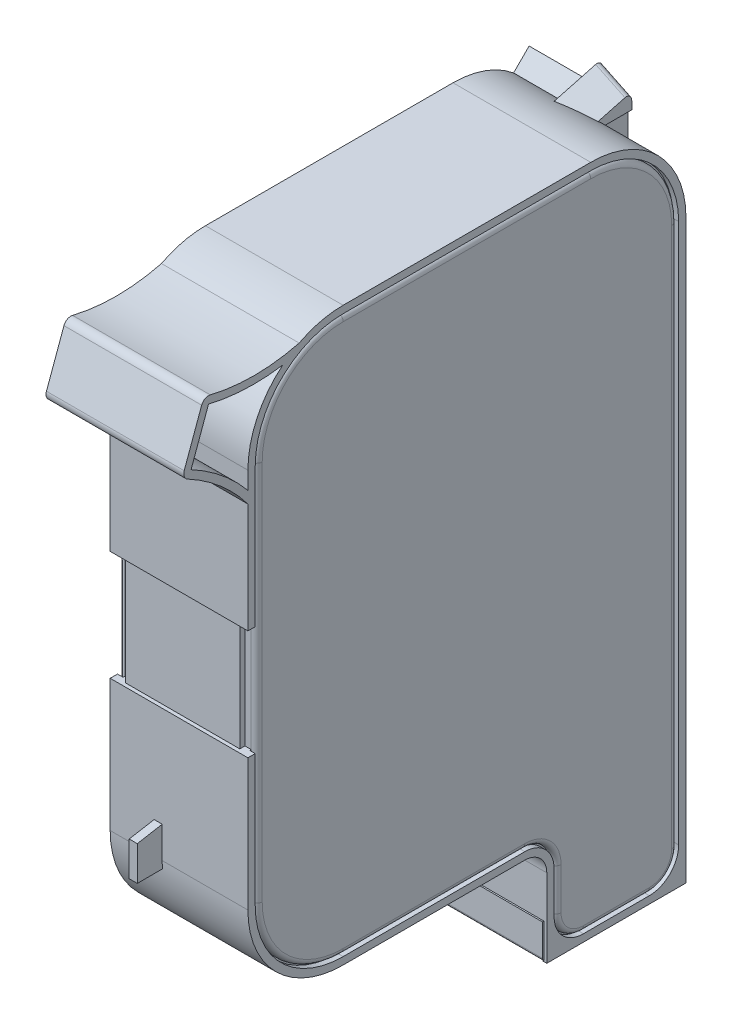
from build123d import *

# Parameters (mm, degrees)
BOSS_EXTRUDE1_DEPTH     = 9.4
CUT_EXTRUDE_THIN1_DEPTH = 0.75
FILLET1_R               = 0.75
BOSS_EXTRUDE2_DEPTH     = 4
CHAMFER1_SIZE           = 1
BOSS_EXTRUDE3_START     = -1.5
BOSS_EXTRUDE3_DEPTH     = 1.5
SKETCH6_W               = 5
SKETCH6_H               = 4
BOSS_EXTRUDE4_DEPTH     = 0.5
BOSS_EXTRUDE4_TAPER     = 45
BOSS_EXTRUDE5_DEPTH     = 18.8
BOSS_EXTRUDE6_START     = -4.5
BOSS_EXTRUDE6_DEPTH     = 2
SKETCH9_W               = 7.088876853
SKETCH9_H               = 8.7
BOSS_EXTRUDE7_DEPTH     = 1
CHAMFER2_SIZE           = 0.5
BOSS_EXTRUDE8_DEPTH     = 2
CUT_EXTRUDE1_DEPTH      = 116.126614853
FILLET2_R               = 0.75
BOSS_EXTRUDE9_REACH     = 118.028
CUT_EXTRUDE2_DEPTH      = 96.832813297
SKETCH15_W              = 18.8
SKETCH15_H              = 15
CUT_EXTRUDE3_DEPTH      = 0.5
CUT_EXTRUDE4_START      = -0.7
SKETCH16_W              = 1.6
SKETCH16_H              = 15
CUT_EXTRUDE4_DEPTH      = 0.7
BOSS_EXTRUDE10_START    = -7.1
BOSS_EXTRUDE10_DEPTH    = 1.1
SKETCH18_W              = 17.8
SKETCH18_H              = 19
CUT_EXTRUDE5_DEPTH      = 0.3
EXTRUDE_THIN1_DEPTH     = 9
SKETCH21_W              = 1.6
SKETCH21_H              = 1.9
BOSS_EXTRUDE11_DEPTH    = 0.1
SKETCH22_W              = 1
SKETCH22_H              = 4.4
BOSS_EXTRUDE12_DEPTH    = 0.3
SKETCH23_R              = 5
BOSS_EXTRUDE13_DEPTH    = 0.5


with BuildPart() as part:
    # Sketch1 → Boss-Extrude1 (new, symmetric)
    with BuildSketch(Plane(origin=(0, 0, 0), x_dir=(0, 0, -1), z_dir=(1, 0, 0))):
        with BuildLine():
            Line((0, 0), (-19, 0))
            Line((-19, 0), (-19, 10.7))
            ThreePointArc((-19, 10.7), (-19.878679656, 12.821320344), (-22, 13.7))
            Line((-22, 13.7), (-46.8, 13.7))
            ThreePointArc((-46.8, 13.7), (-55.992388155, 17.507611845), (-59.8, 26.7))
            Line((-59.8, 26.7), (-59.8, 78.7))
            ThreePointArc((-59.8, 78.7), (-55.992388155, 87.892388155), (-46.8, 91.7))
            Line((-46.8, 91.7), (-13, 91.7))
            ThreePointArc((-13, 91.7), (-3.807611845, 87.892388155), (0, 78.7))
            Line((0, 78.7), (0, 0))
        make_face()
    extrude(amount=BOSS_EXTRUDE1_DEPTH, both=True)

    # Sketch2 → Cut-Extrude-Thin1 (cut)
    with BuildSketch(Plane(origin=(9.4, 0, 0), x_dir=(0, 0, -1), z_dir=(1, 0, 0))):
        with BuildLine():
            Line((-18, 10.7), (-18, 5))
            ThreePointArc((-18, 5), (-16.828427125, 2.171572875), (-14, 1))
            Line((-14, 1), (-5, 1))
            ThreePointArc((-5, 1), (-2.171572875, 2.171572875), (-1, 5))
            Line((-1, 5), (-1, 78.7))
            ThreePointArc((-1, 78.7), (-4.514718626, 87.185281374), (-13, 90.7))
            Line((-13, 90.7), (-46.8, 90.7))
            ThreePointArc((-46.8, 90.7), (-55.285281374, 87.185281374), (-58.8, 78.7))
            Line((-58.8, 78.7), (-58.8, 26.7))
            ThreePointArc((-58.8, 26.7), (-55.285281374, 18.214718626), (-46.8, 14.7))
            Line((-46.8, 14.7), (-22, 14.7))
            ThreePointArc((-22, 14.7), (-19.171572875, 13.528427125), (-18, 10.7))
        make_face()
        with BuildLine():
            Line((-17.8, 10.7), (-17.8, 5))
            ThreePointArc((-17.8, 5), (-16.687005769, 2.312994231), (-14, 1.2))
            Line((-14, 1.2), (-5, 1.2))
            ThreePointArc((-5, 1.2), (-2.312994231, 2.312994231), (-1.2, 5))
            Line((-1.2, 5), (-1.2, 78.7))
            ThreePointArc((-1.2, 78.7), (-4.656139982, 87.043860018), (-13, 90.5))
            Line((-13, 90.5), (-46.8, 90.5))
            ThreePointArc((-46.8, 90.5), (-55.143860018, 87.043860018), (-58.6, 78.7))
            Line((-58.6, 78.7), (-58.6, 26.7))
            ThreePointArc((-58.6, 26.7), (-55.143860018, 18.356139982), (-46.8, 14.9))
            Line((-46.8, 14.9), (-22, 14.9))
            ThreePointArc((-22, 14.9), (-19.030151519, 13.669848481), (-17.8, 10.7))
        make_face(mode=Mode.SUBTRACT)
    cut_extrude_thin1 = extrude(amount=-CUT_EXTRUDE_THIN1_DEPTH, mode=Mode.SUBTRACT)

    # Mirror2: Cut-Extrude-Thin1 across plane
    add(cut_extrude_thin1.mirror(Plane(origin=(0, 0, 0), x_dir=(0, 0, 1), z_dir=(1, 0, 0))), mode=Mode.SUBTRACT)

    # Fillet1
    fillet1_edges = [part.edges().sort_by_distance(p)[0] for p in [
        (9.4, 14.9, 34.4),
        (9.4, 18.356139982, 55.143860018),
        (9.4, 52.7, 58.6),
        (9.4, 87.043860018, 55.143860018),
        (9.4, 90.5, 29.9),
        (9.4, 87.043860018, 4.656139982),
        (9.4, 41.85, 1.2),
        (9.4, 2.312994231, 2.312994231),
        (9.4, 1.2, 9.5),
        (9.4, 2.312994231, 16.687005769),
        (9.4, 7.85, 17.8),
        (9.4, 13.669848481, 19.030151519),
        (-9.4, 87.043860018, 4.656139982),
        (-9.4, 41.85, 1.2),
        (-9.4, 2.312994231, 2.312994231),
        (-9.4, 1.2, 9.5),
        (-9.4, 2.312994231, 16.687005769),
        (-9.4, 7.85, 17.8),
        (-9.4, 13.669848481, 19.030151519),
        (-9.4, 14.9, 34.4),
        (-9.4, 18.356139982, 55.143860018),
        (-9.4, 52.7, 58.6),
        (-9.4, 87.043860018, 55.143860018),
        (-9.4, 90.5, 29.9),
    ]]
    fillet(fillet1_edges, radius=FILLET1_R - 0.0001)  # a hair under: the kernel refuses the full size

    # Sketch4 → Boss-Extrude2 (add)
    with BuildSketch(Plane.XZ.offset(-13.7)):
        with BuildLine():
            Line((-3.5, 19), (-2, 19))
            Line((-2, 19), (-2, 24.1))
            ThreePointArc((-2, 24.1), (-1.707106781, 24.807106781), (-1, 25.1))
            Line((-1, 25.1), (1, 25.1))
            ThreePointArc((1, 25.1), (1.707106781, 24.807106781), (2, 24.1))
            Line((2, 24.1), (2, 19))
            Line((2, 19), (3.5, 19))
            Line((3.5, 19), (3.5, 26.5))
            Line((3.5, 26.5), (-3.5, 26.5))
            Line((-3.5, 26.5), (-3.5, 19))
        make_face()
    extrude(amount=BOSS_EXTRUDE2_DEPTH)

    # Chamfer1
    chamfer1_edges = [part.edges().sort_by_distance(p)[0] for p in [
        (-3.5, 11.7, 26.5),
        (3.5, 11.7, 26.5),
    ]]
    chamfer(chamfer1_edges, length=CHAMFER1_SIZE)

    # Sketch5 → Boss-Extrude3 (add)
    with BuildSketch(Plane.ZY.offset(9.4).offset(BOSS_EXTRUDE3_START)):
        with BuildLine():
            Line((19, 9.7), (23.75, 9.7))
            Line((23.75, 9.7), (23.75, 13.7))
            Line((23.75, 13.7), (22, 13.7))
            ThreePointArc((22, 13.7), (19.878679656, 12.821320344), (19, 10.7))
            Line((19, 10.7), (19, 9.7))
        make_face()
    extrude(amount=BOSS_EXTRUDE3_DEPTH)

    # Sketch6 → Boss-Extrude4 (add)
    with BuildSketch(Plane.XZ.offset(-13.7)):
        with Locations((-6.9, 29)):
            Rectangle(SKETCH6_W, SKETCH6_H)
    extrude(amount=BOSS_EXTRUDE4_DEPTH, taper=BOSS_EXTRUDE4_TAPER)

    # Sketch7 → Boss-Extrude5 (add)
    with BuildSketch(Plane(origin=(9.4, 0, 0), x_dir=(0, 0, -1), z_dir=(1, 0, 0))):
        with BuildLine():
            Line((-68.498089729, 82.987059393), (-66.112162722, 89.54233997))
            ThreePointArc((-66.112162722, 89.54233997), (-65.643805193, 90.082274038), (-64.934648424, 90.171628661))
            ThreePointArc((-64.934648424, 90.171628661), (-58.863571, 89.454664682), (-52.8, 90.232562595))
            ThreePointArc((-52.8, 90.232562595), (-53.957382069, 89.552275426), (-55.038433247, 88.756252664))
            ThreePointArc((-55.038433247, 88.756252664), (-55.89132041, 88.639552939), (-56.747603385, 88.551151552))
            ThreePointArc((-56.747603385, 88.551151552), (-60.986585132, 88.531192299), (-65.172470101, 89.200319827))
            Line((-65.172470101, 89.200319827), (-67.558397109, 82.64503925))
            ThreePointArc((-67.558397109, 82.64503925), (-63.964878457, 80.326676695), (-60.8, 77.450615918))
            ThreePointArc((-60.8, 77.450615918), (-60.291730303, 76.889795773), (-59.8, 76.314418829))
            Line((-59.8, 76.314418829), (-59.8, 74.7))
            ThreePointArc((-59.8, 74.7), (-63.527186359, 78.683120903), (-68.029575416, 81.763001267))
            ThreePointArc((-68.029575416, 81.763001267), (-68.492323641, 82.287574242), (-68.498089729, 82.987059393))
        make_face()
    extrude(amount=-BOSS_EXTRUDE5_DEPTH)

    # Sketch8 → Boss-Extrude6 (add)
    with BuildSketch(Plane.ZY.offset(9.4).offset(BOSS_EXTRUDE6_START)):
        with BuildLine():
            Line((59.8, 78.7), (59.8, 76.314418829))
            ThreePointArc((59.8, 76.314418829), (63.371553026, 79.856759412), (67.558397109, 82.64503925))
            Line((67.558397109, 82.64503925), (65.172470101, 89.200319827))
            ThreePointArc((65.172470101, 89.200319827), (60.127318018, 88.479275396), (55.038433247, 88.756252664))
            ThreePointArc((55.038433247, 88.756252664), (58.549460247, 84.263288946), (59.8, 78.7))
        make_face()
    extrude(amount=BOSS_EXTRUDE6_DEPTH)

    # Sketch9 → Boss-Extrude7 (add, symmetric)
    with BuildSketch(Plane(origin=(0, 0, 0), x_dir=(0, 0, -1), z_dir=(1, 0, 0))):
        with Locations((-3.044438427, 83.35)):
            Rectangle(SKETCH9_W, SKETCH9_H)
    extrude(amount=BOSS_EXTRUDE7_DEPTH, both=True)

    # Chamfer2
    chamfer2_edges = [part.edges().sort_by_distance(p)[0] for p in [
        (0, 79, -0.5),
        (0, 87.7, -0.5),
    ]]
    chamfer(chamfer2_edges, length=CHAMFER2_SIZE)

    # Boss-Extrude9: up to this face of the body (flat: up to its plane)
    boss_extrude9_end = Plane(part.part.faces().sort_by_distance((-1, 84.894883445, 0.680703174))[0])
    # Sketch13 → Boss-Extrude9 (add, up to the picked face)
    with BuildSketch(Plane.ZY.offset(9.4), mode=Mode.PRIVATE) as boss_extrude9_sk1:
        Polygon((2.966321444, 86.965911603), (4.734088397, 88.733678556), (2.612768053, 90.8549989), (0.8450011, 89.087231947), align=None)
    boss_extrude9_tool1 = split(extrude(boss_extrude9_sk1.sketch, amount=-BOSS_EXTRUDE9_REACH, mode=Mode.PRIVATE), bisect_by=boss_extrude9_end, keep=Keep.BOTH, mode=Mode.PRIVATE)


with BuildPart() as body_2:
    # Sketch11 → Boss-Extrude8 (new, symmetric)
    with BuildSketch(Plane(origin=(0, 0, 0), x_dir=(0, 0, -1), z_dir=(1, 0, 0))):
        Polygon((-0.755291427, 91.579555496), (-6.597594331, 90.014115151), (-6.597594331, 87.7), (0, 87.7), (0, 91), (0, 91.781935224), align=None)
    extrude(amount=BOSS_EXTRUDE8_DEPTH, both=True)

    # Sketch12 → Cut-Extrude1 (cut, through all)
    with BuildSketch(Plane(origin=(-2, 91.781935224, 0), x_dir=(1, 0, 0), z_dir=(0, -0.25881904510251635, 0.9659258262890695))):
        Polygon((0, 0), (4, -1.865230633), (4, 0), align=None)
    extrude(amount=CUT_EXTRUDE1_DEPTH, mode=Mode.SUBTRACT)

    # Fillet2
    fillet2_edges = [body_2.edges().sort_by_distance(p)[0] for p in [
        (0, 90.816420801, 0),
    ]]
    fillet(fillet2_edges, radius=FILLET2_R)


with BuildPart() as part_1:
    add(part.part)

    add(body_2.part)  # Boss-Extrude9 merges body 2
    add(boss_extrude9_tool1.solids().sort_by(Axis((-9.4, 88.910455, 2.789545), (1, 0, 0)))[0])

    # Sketch14 → Cut-Extrude2 (cut, through all)
    with BuildSketch(Plane(origin=(33.599447092, 69.599057892, 18.649011356), x_dir=(0.9063077870366525, -0.40821789367673017, -0.10938165494661176), z_dir=(0.42261826174069406, 0.8754260980655965, 0.23456971600980117))):
        Polygon((-38.761167432, 20.991263917), (-38.17626593, 20.563118181), (-38.17626593, 21.133979163), align=None)
    extrude(amount=CUT_EXTRUDE2_DEPTH, mode=Mode.SUBTRACT)

    # Sketch15 → Cut-Extrude3 (cut)
    with BuildSketch(Plane(origin=(0, 0, 59.8), x_dir=(-1, 0, 0), z_dir=(0, 0, -1))):
        with Locations((0, 52.2)):
            Rectangle(SKETCH15_W, SKETCH15_H)
    extrude(amount=CUT_EXTRUDE3_DEPTH, mode=Mode.SUBTRACT)

    # Sketch16 → Cut-Extrude4 (cut)
    with BuildSketch(Plane.XY.offset(59.3).offset(CUT_EXTRUDE4_START)):
        with Locations((-8.6, 52.2)):
            Rectangle(SKETCH16_W, SKETCH16_H)
        with Locations((8.6, 52.2)):
            Rectangle(SKETCH16_W, SKETCH16_H)
    extrude(amount=CUT_EXTRUDE4_DEPTH, mode=Mode.SUBTRACT)

    # Sketch17 → Boss-Extrude10 (add)
    with BuildSketch(Plane.ZY.offset(9.4).offset(BOSS_EXTRUDE10_START)):
        with BuildLine():
            Line((59.8, 25.7), (63.2, 25.7))
            Line((63.2, 25.7), (63.2, 30.400488266))
            Line((63.2, 30.400488266), (59.8, 31))
            Line((59.8, 31), (59.8, 26.7))
            ThreePointArc((59.8, 26.7), (59.79036678, 26.199629217), (59.761481397, 25.7))
            Line((59.761481397, 25.7), (59.8, 25.7))
        make_face()
    extrude(amount=BOSS_EXTRUDE10_DEPTH)

    # Sketch18 → Cut-Extrude5 (cut)
    with BuildSketch(Plane.XZ):
        with Locations((0, 9.5)):
            Rectangle(SKETCH18_W, SKETCH18_H)
    extrude(amount=-CUT_EXTRUDE5_DEPTH, mode=Mode.SUBTRACT)

    # Sketch22 → Boss-Extrude12 (add)
    with BuildSketch(Plane.ZY.offset(9.4)):
        with Locations((0.5, 12.2)):
            Rectangle(SKETCH22_W, SKETCH22_H)
    extrude(amount=BOSS_EXTRUDE12_DEPTH)

    # Sketch23 → Boss-Extrude13 (add)
    with BuildSketch(Plane.XZ.offset(-13.7)):
        with Locations(Location((0, 38, 0), (0, 0, 270))):
            Circle(SKETCH23_R)
    extrude(amount=BOSS_EXTRUDE13_DEPTH)


with BuildPart() as body_2_2:
    # Sketch19 → Extrude-Thin1 (new, symmetric)
    with BuildSketch(Plane(origin=(0, 0, 0), x_dir=(0, 0, -1), z_dir=(1, 0, 0))):
        with BuildLine():
            Line((-19, 4.8), (-19, 0.5))
            ThreePointArc((-19, 0.5), (-18.941421356, 0.358578644), (-18.8, 0.3))
            Line((-18.8, 0.3), (-0.2, 0.3))
            ThreePointArc((-0.2, 0.3), (-0.058578644, 0.358578644), (0, 0.5))
            Line((0, 0.5), (0, 44.3))
            Line((0, 44.3), (0.2, 44.3))
            Line((0.2, 44.3), (0.2, 0.5))
            ThreePointArc((0.2, 0.5), (0.082842712, 0.217157288), (-0.2, 0.1))
            Line((-0.2, 0.1), (-18.8, 0.1))
            ThreePointArc((-18.8, 0.1), (-19.082842712, 0.217157288), (-19.2, 0.5))
            Line((-19.2, 0.5), (-19.2, 4.8))
            Line((-19.2, 4.8), (-19, 4.8))
        make_face()
    extrude(amount=EXTRUDE_THIN1_DEPTH, both=True)

    # Sketch21 → Boss-Extrude11 (add)
    with BuildSketch(Plane(origin=(0, 0, -0.2), x_dir=(-1, 0, 0), z_dir=(0, 0, -1))):
        with Locations((-7.05, 37.75)):
            Rectangle(SKETCH21_W, SKETCH21_H)
        with Locations((-7.05, 35.45)):
            Rectangle(SKETCH21_W, SKETCH21_H)
        with Locations((-7.05, 33.1)):
            Rectangle(SKETCH21_W, SKETCH21_H)
        with Locations((-7.05, 30.85)):
            Rectangle(SKETCH21_W, SKETCH21_H)
        with Locations((-7.05, 28.55)):
            Rectangle(SKETCH21_W, SKETCH21_H)
        with Locations((-7.05, 26.4)):
            Rectangle(SKETCH21_W, SKETCH21_H)
        with Locations((-7.05, 24.3)):
            Rectangle(SKETCH21_W, SKETCH21_H)
        with Locations((-7.05, 22.2)):
            Rectangle(SKETCH21_W, SKETCH21_H)
        with Locations((-7.05, 20.05)):
            Rectangle(SKETCH21_W, SKETCH21_H)
        with Locations((-7.05, 17.95)):
            Rectangle(SKETCH21_W, SKETCH21_H)
        with Locations((-7.05, 15.85)):
            Rectangle(SKETCH21_W, SKETCH21_H)
        with Locations((-5.2, 37.95)):
            Rectangle(SKETCH21_W, SKETCH21_H)
        with Locations((-5.2, 35.65)):
            Rectangle(SKETCH21_W, SKETCH21_H)
        with Locations((-5.2, 33.35)):
            Rectangle(SKETCH21_W, SKETCH21_H)
        with Locations((-5.2, 31.05)):
            Rectangle(SKETCH21_W, SKETCH21_H)
        with Locations((-5.025, 28.85)):
            Rectangle(SKETCH21_W, SKETCH21_H)
        with Locations((-5.2, 26.6)):
            Rectangle(SKETCH21_W, SKETCH21_H)
        with Locations((-5.2, 24.5)):
            Rectangle(SKETCH21_W, SKETCH21_H)
        with Locations((-5.2, 22.45)):
            Rectangle(SKETCH21_W, SKETCH21_H)
        with Locations((-5.2, 20.35)):
            Rectangle(SKETCH21_W, SKETCH21_H)
        with Locations((-5.2, 18.2)):
            Rectangle(SKETCH21_W, SKETCH21_H)
        with Locations((-5.2, 16.05)):
            Rectangle(SKETCH21_W, SKETCH21_H)
        with Locations((-3.35, 38.15)):
            Rectangle(SKETCH21_W, SKETCH21_H)
        with Locations((-3.35, 35.85)):
            Rectangle(SKETCH21_W, SKETCH21_H)
        with Locations((-3.35, 33.55)):
            Rectangle(SKETCH21_W, SKETCH21_H)
        with Locations((-3.35, 31.25)):
            Rectangle(SKETCH21_W, SKETCH21_H)
    boss_extrude11 = extrude(amount=BOSS_EXTRUDE11_DEPTH)

    # Mirror3: Boss-Extrude11 across plane
    add(boss_extrude11.mirror(Plane(origin=(0, 0, 0), x_dir=(0, 0, 1), z_dir=(1, 0, 0))))


solid = Compound([part_1.part, body_2_2.part])
